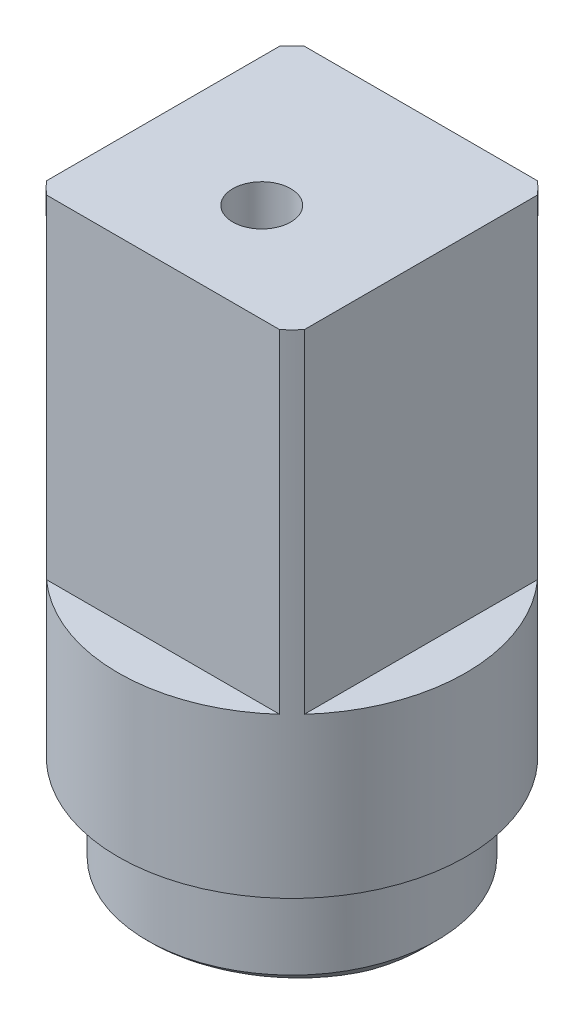
from build123d import *

# Parameters (mm, degrees)
SKETCH1_R               = 6
BOSS_EXTRUDE1_DEPTH     = 17
SKETCH2_OUTSIDE_W       = 18.804
SKETCH2_OUTSIDE_H       = 18.804
SKETCH2_OUTSIDE_W_2     = 8.9
SKETCH2_OUTSIDE_H_2     = 8.9
CUT_EXTRUDE1_DEPTH      = 11.5
SKETCH3_R               = 5
BOSS_EXTRUDE2_DEPTH     = 3.5
CUT_EXTRUDE2_DEPTH      = 20
CUT_EXTRUDE2_DEPTH_BACK = 20
SKETCH5_W               = 1.5
SKETCH5_H               = 3.5
FILLET2_R               = 1
CUT_EXTRUDE3_DEPTH      = 7
CUT_EXTRUDE4_DEPTH      = 8
SKETCH8_R               = 1
CUT_EXTRUDE5_DEPTH      = 18.233688027
CHAMFER1_START          = -6
CHAMFER1_2_OUTLINE_W    = 10
CHAMFER1_2_OUTLINE_H    = 4
CHAMFER1_2_DEPTH        = 1.403805922


with BuildPart() as part:
    # Sketch1 → Boss-Extrude1 (new body)
    with BuildSketch(Plane(origin=(0, 0, 0), x_dir=(1, 0, 0), z_dir=(0, 1, 0))):
        with Locations(Location((0, 0, 0), (0, 0, 270))):
            Circle(SKETCH1_R)
    extrude(amount=BOSS_EXTRUDE1_DEPTH)

    # Sketch2 outside → Cut-Extrude1 (cut)
    with BuildSketch(Plane(origin=(0, 17, 0), x_dir=(1, 0, 0), z_dir=(0, 1, 0))):
        Rectangle(SKETCH2_OUTSIDE_W, SKETCH2_OUTSIDE_H)
        Rectangle(SKETCH2_OUTSIDE_W_2, SKETCH2_OUTSIDE_H_2, mode=Mode.SUBTRACT)
    extrude(amount=-CUT_EXTRUDE1_DEPTH, mode=Mode.SUBTRACT)

    # Sketch3 → Boss-Extrude2 (add)
    with BuildSketch(Plane.XZ):
        with Locations(Location((0, 0, 0), (0, 0, 270))):
            Circle(SKETCH3_R)
    extrude(amount=BOSS_EXTRUDE2_DEPTH)

    # Sketch4 → Cut-Revolve2 (revolve, cut)
    with BuildSketch(Plane(origin=(0, -7.347807266, 1), x_dir=(0, 0, -1), z_dir=(1, 0, 0))):
        with BuildLine():
            Line((0, 5.75), (0, -5.75))
            ThreePointArc((0, -5.75), (-5.75, 0), (0, 5.75))
        make_face()
    revolve(axis=Axis((0, -1.597807266, 1), (0, -1, 0)), mode=Mode.SUBTRACT)

    # Sketch5 → Cut-Extrude2 (cut, two sides: drawn at the far end of the back side and taken through both)
    with BuildSketch(Plane(origin=(0, 0, 0), x_dir=(0, 0, -1), z_dir=(1, 0, 0)).offset(-CUT_EXTRUDE2_DEPTH_BACK)):
        with Locations((4.25, -1.75)):
            Rectangle(SKETCH5_W, SKETCH5_H)
    extrude(amount=CUT_EXTRUDE2_DEPTH + CUT_EXTRUDE2_DEPTH_BACK, mode=Mode.SUBTRACT)

    # Fillet2
    fillet2_edges = [part.edges().sort_by_distance(p)[0] for p in [
        (0, 0, -3.5),
    ]]
    fillet(fillet2_edges, radius=FILLET2_R)

    # Sketch6 → Cut-Extrude3 (cut)
    with BuildSketch(Plane.XZ.offset(3.5)):
        with BuildLine():
            Line((2.1, -2.1), (-2.1, -2.1))
            ThreePointArc((-2.1, -2.1), (-2.807106781, -1.807106781), (-3.1, -1.1))
            Line((-3.1, -1.1), (-3.1, 3.1))
            ThreePointArc((-3.1, 3.1), (-2.807106781, 3.807106781), (-2.1, 4.1))
            Line((-2.1, 4.1), (2.1, 4.1))
            ThreePointArc((2.1, 4.1), (2.807106781, 3.807106781), (3.1, 3.1))
            Line((3.1, 3.1), (3.1, -1.1))
            ThreePointArc((3.1, -1.1), (2.807106781, -1.807106781), (2.1, -2.1))
        make_face()
    extrude(amount=-CUT_EXTRUDE3_DEPTH, mode=Mode.SUBTRACT)

    # Sketch7 → Cut-Extrude4 (cut)
    with BuildSketch(Plane.XZ.offset(-3.5)):
        with BuildLine():
            Line((2.1, -1.1), (-2.1, -1.1))
            ThreePointArc((-2.1, -1.1), (-2.807106781, -0.807106781), (-3.1, -0.1))
            Line((-3.1, -0.1), (-3.1, 2.1))
            ThreePointArc((-3.1, 2.1), (-2.807106781, 2.807106781), (-2.1, 3.1))
            Line((-2.1, 3.1), (2.1, 3.1))
            ThreePointArc((2.1, 3.1), (2.807106781, 2.807106781), (3.1, 2.1))
            Line((3.1, 2.1), (3.1, -0.1))
            ThreePointArc((3.1, -0.1), (2.807106781, -0.807106781), (2.1, -1.1))
        make_face()
    extrude(amount=-CUT_EXTRUDE4_DEPTH, mode=Mode.SUBTRACT)

    # Sketch8 → Cut-Extrude5 (cut, through all)
    with BuildSketch(Plane.XZ.offset(-11.5)):
        with Locations(Location((0, 1.043592984, 0), (0, 0, 270))):
            Circle(SKETCH8_R)
    extrude(amount=-CUT_EXTRUDE5_DEPTH, mode=Mode.SUBTRACT)

    # Chamfer1: read off the stored shape, not the designer's step
    # Chamfer1 outline → Chamfer1 (revolve, cut)
    with BuildSketch(Plane.XY):
        Polygon((5, -3), (4.5, -3.5), (5, -3.5), align=None)
    revolve(axis=Axis((0, 0, 0), (0, 1, 0)), mode=Mode.SUBTRACT)

    # Chamfer1 2 outline → Chamfer1 2 (cut)
    with BuildSketch(Plane(origin=(0, 0, 0), x_dir=(1, 0, 0), z_dir=(0, 0.707106781186544, 0.707106781186551)).offset(CHAMFER1_START)):
        Rectangle(CHAMFER1_2_OUTLINE_W, CHAMFER1_2_OUTLINE_H)
    extrude(amount=CHAMFER1_2_DEPTH, mode=Mode.SUBTRACT)


solid = part.part
